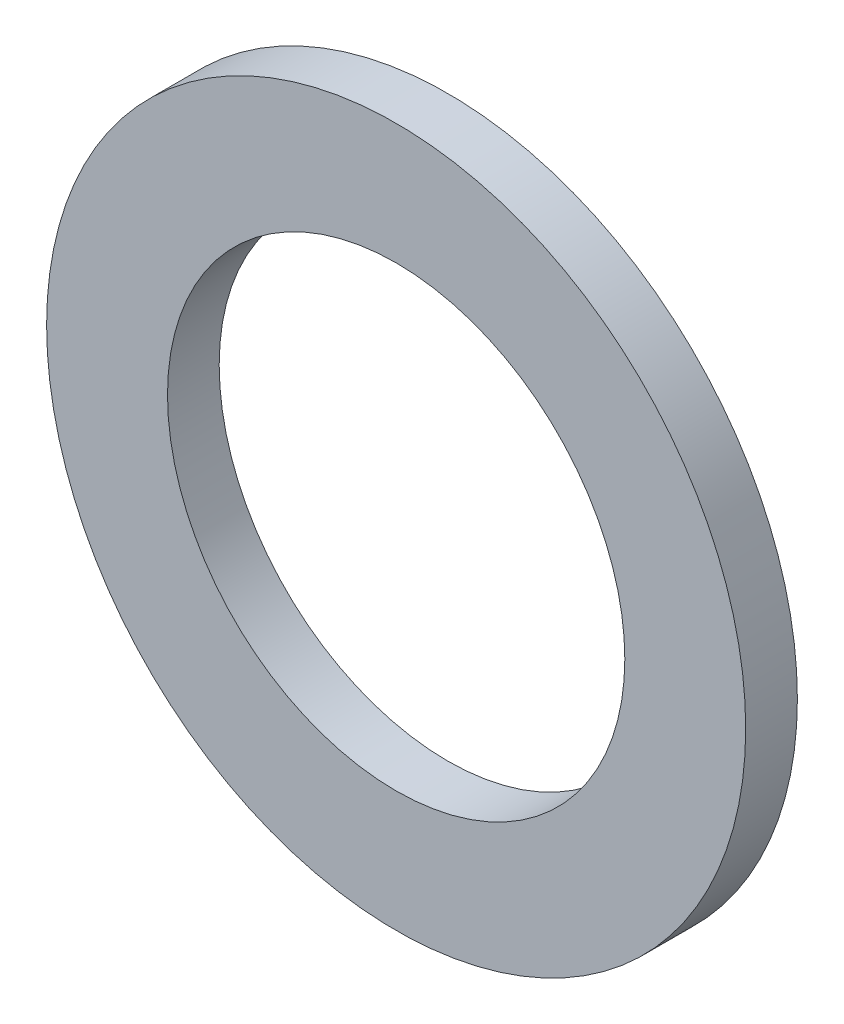
from build123d import *

# Parameters (mm, degrees)
SKETCH1_R           = 10.308984838
SKETCH1_R_2         = 6.7437
BOSS_EXTRUDE1_DEPTH = 1.524


with BuildPart() as part:
    # Sketch1 → Boss-Extrude1 (new body)
    with BuildSketch(Plane.XY):
        with Locations((9.468478572, -4.905028475)):
            Circle(SKETCH1_R)
        with Locations((9.468478572, -4.905028475)):
            Circle(SKETCH1_R_2, mode=Mode.SUBTRACT)
    extrude(amount=BOSS_EXTRUDE1_DEPTH)


solid = part.part
